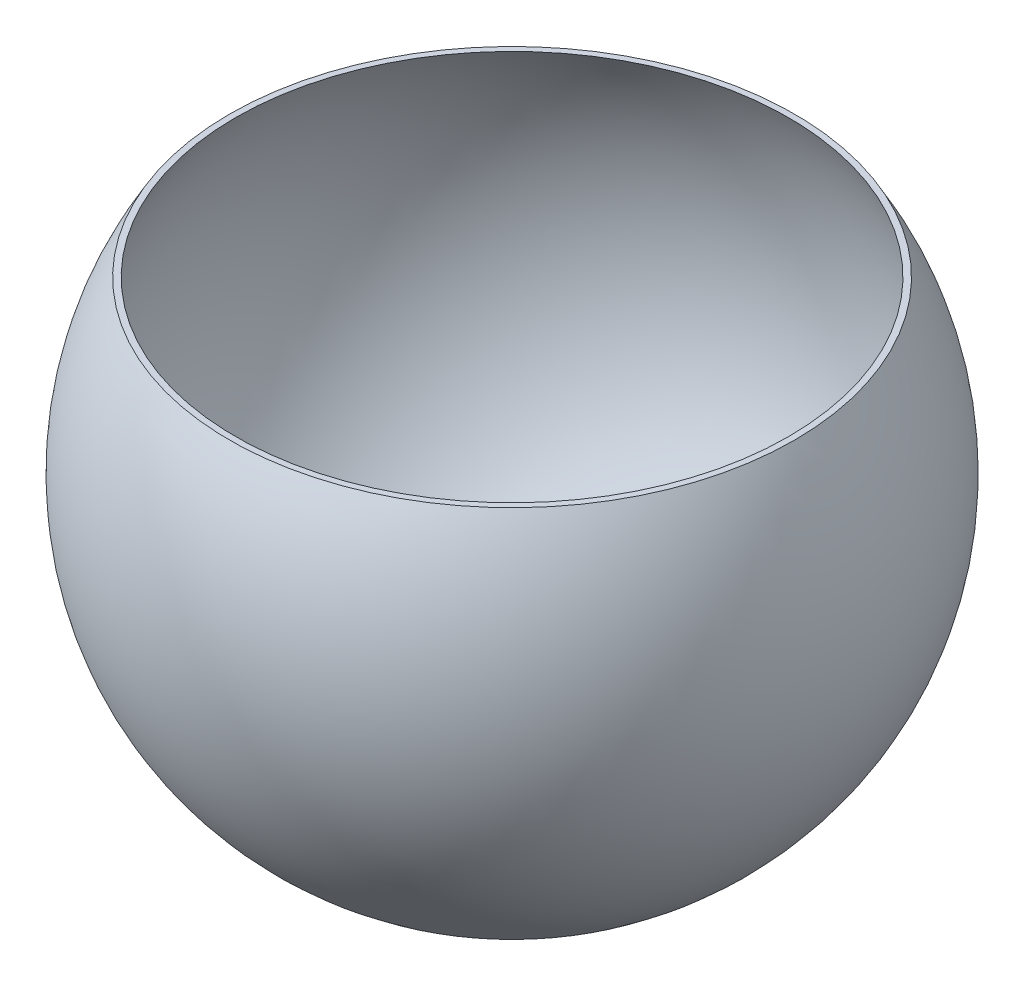
from build123d import *


with BuildPart() as part:
    # Sketch1 → Revolve1 (revolve)
    with BuildSketch(Plane.XY):
        with BuildLine():
            Line((174.101233777, 194.668503093), (170.38485915, 194.668503093))
            ThreePointArc((170.38485915, 194.668503093), (174.597773763, -7.711494873), (0, -110.137222222))
            Line((0, -110.137222222), (0, -113.312222222))
            ThreePointArc((0, -113.312222222), (176.892175327, -10.109213717), (174.101233777, 194.668503093))
        make_face()
    revolve(axis=Axis((0, 0, 0), (0, -1, 0)))


solid = part.part
